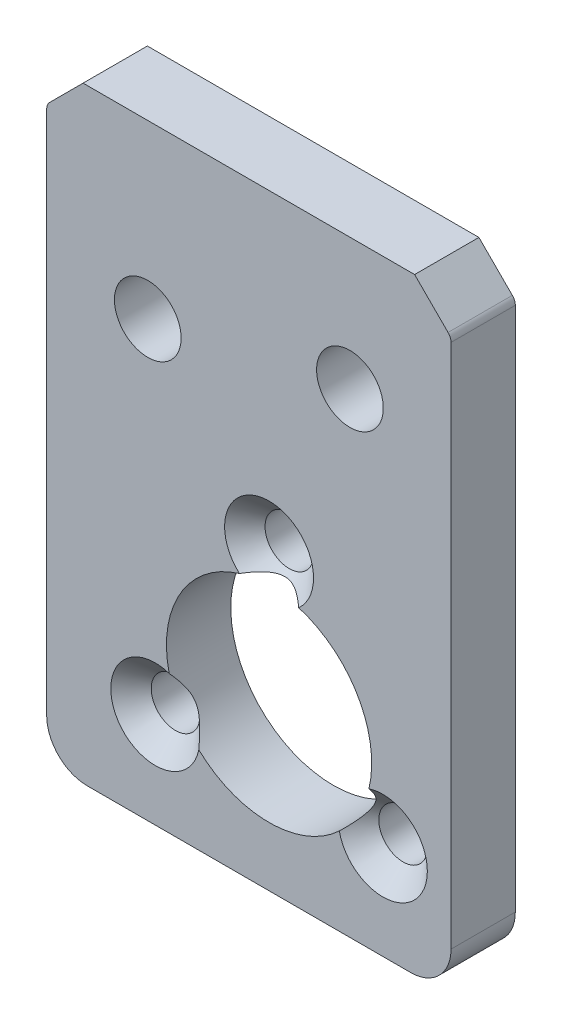
from build123d import *

# Parameters (mm, degrees)
SKETCH12_W                                      = 20
SKETCH12_H                                      = 30
SKETCH12_R                                      = 5.075
SKETCH12_R_2                                    = 1.65
BOSS_EXTRUDE3_DEPTH                             = 3.18
CSK_FOR_M2_FLAT_HEAD_MACHINE_SCREW2_D           = 2.4
CSK_FOR_M2_FLAT_HEAD_MACHINE_SCREW2_CSINK_D     = 4.4
CSK_FOR_M2_FLAT_HEAD_MACHINE_SCREW2_CSINK_ANGLE = 90
CHAMFER1_SIZE                                   = 1.8
FILLET3_R                                       = 0.5
FILLET4_R                                       = 2


with BuildPart() as part:
    # Sketch12 → Boss-Extrude3 (new body)
    with BuildSketch(Plane.XY):
        with Locations((-10, -15)):
            Rectangle(SKETCH12_W, SKETCH12_H)
        with Locations((-9, -22)):
            Circle(SKETCH12_R, mode=Mode.SUBTRACT)
        with Locations((-5, -6.5)):
            Circle(SKETCH12_R_2, mode=Mode.SUBTRACT)
        with Locations((-15, -8.5)):
            Circle(SKETCH12_R_2, mode=Mode.SUBTRACT)
    extrude(amount=BOSS_EXTRUDE3_DEPTH)

    # CSK for M2 Flat Head Machine Screw2 (through all)
    with Locations(Plane.XY.offset(3.18)):
        with Locations((-9, -15.5), (-14.629165125, -25.25), (-3.370834875, -25.25)):
            CounterSinkHole(CSK_FOR_M2_FLAT_HEAD_MACHINE_SCREW2_D / 2, CSK_FOR_M2_FLAT_HEAD_MACHINE_SCREW2_CSINK_D / 2, counter_sink_angle=CSK_FOR_M2_FLAT_HEAD_MACHINE_SCREW2_CSINK_ANGLE)

    # Chamfer1
    chamfer1_edges = [part.edges().sort_by_distance(p)[0] for p in [
        (-20, 0, 1.59),
        (0, 0, 1.59),
    ]]
    chamfer(chamfer1_edges, length=CHAMFER1_SIZE)

    # Fillet3
    fillet3_edges = [part.edges().sort_by_distance(p)[0] for p in [
        (-20, -1.8, 1.59),
        (0, -1.8, 1.59),
    ]]
    fillet(fillet3_edges, radius=FILLET3_R)

    # Fillet4
    fillet4_edges = [part.edges().sort_by_distance(p)[0] for p in [
        (-20, -30, 1.59),
        (0, -30, 1.59),
    ]]
    fillet(fillet4_edges, radius=FILLET4_R)


solid = part.part
